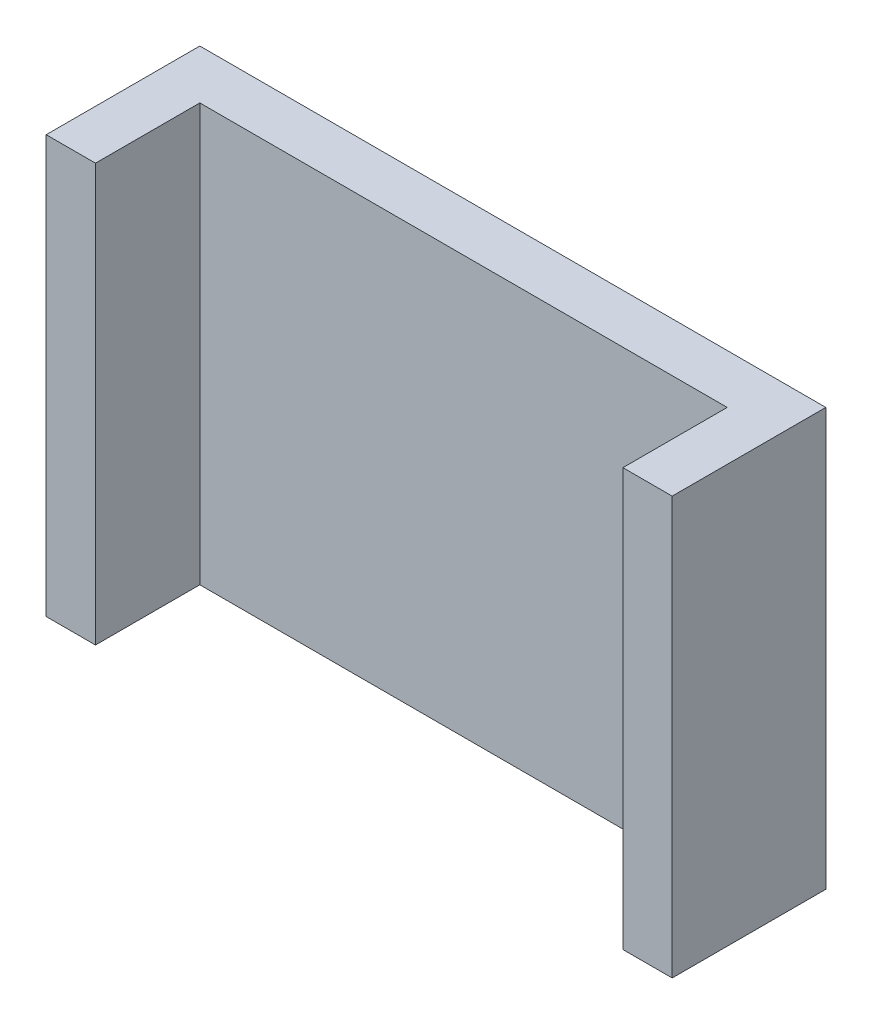
from build123d import *

# Parameters (mm, degrees)
BOSS_EXTRUDE1_DEPTH = 50.8


with BuildPart() as part:
    # Sketch3 → Boss-Extrude1 (new body)
    with BuildSketch(Plane(origin=(0, 0, 0), x_dir=(1, 0, 0), z_dir=(0, 1, 0))):
        Polygon((-38.1, 3), (-38.1, -15.7), (-32.1, -15.7), (-32.1, -3), (32.1, -3), (32.1, -15.7), (38.1, -15.7), (38.1, 3), align=None)
    extrude(amount=BOSS_EXTRUDE1_DEPTH)


solid = part.part
